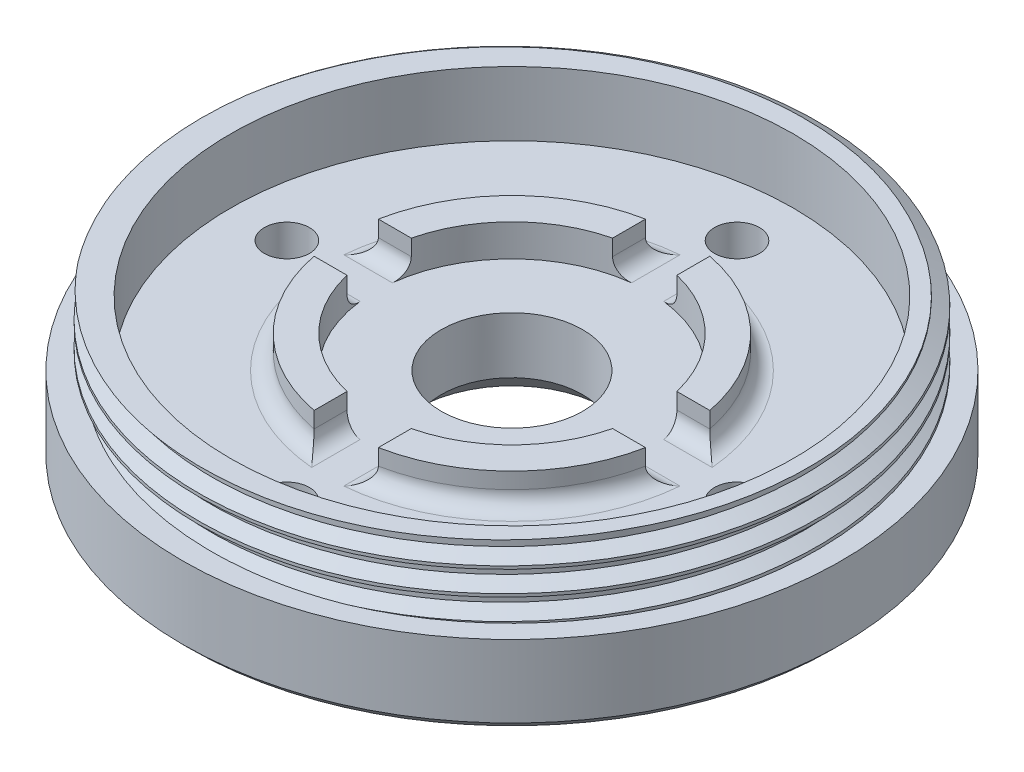
from build123d import *

# Parameters (mm, degrees)
SKETCH1_R       = 20.5
SKETCH1_R_2     = 4.4
SKETCH1_R_3     = 1.4
EXTRUDE1_DEPTH  = 5
SKETCH8_R       = 18.45
SKETCH8_R_2     = 17.5
EXTRUDE_1_DEPTH = 4
THREAD_1_PITCH  = 1.5
THREAD_1_FROM   = 2
EXTRUDE_2_DEPTH = 2
FILLET_1_R      = 1
CHAMFER2_SIZE   = 1.5
CHAMFER3_SIZE   = 0.5
CHAMFER4_SIZE   = 1


with BuildPart() as part:
    # Sketch1 → Extrude1 (new body)
    with BuildSketch(Plane(origin=(0, 0, 0), x_dir=(1, 0, 0), z_dir=(0, 1, 0))):
        with Locations(Location((0, 0, 0), (0, 0, 270))):
            Circle(SKETCH1_R)
        with Locations(Location((0, 0, 0), (0, 0, 270))):
            Circle(SKETCH1_R_2, mode=Mode.SUBTRACT)
        with Locations(Location((0, 14, 0), (0, 0, 270))):
            Circle(SKETCH1_R_3, mode=Mode.SUBTRACT)
        with Locations(Location((14, 0, 0), (0, 0, 270))):
            Circle(SKETCH1_R_3, mode=Mode.SUBTRACT)
        with Locations(Location((0, -14, 0), (0, 0, 270))):
            Circle(SKETCH1_R_3, mode=Mode.SUBTRACT)
        with Locations(Location((-14, 0, 0), (0, 0, 270))):
            Circle(SKETCH1_R_3, mode=Mode.SUBTRACT)
    extrude(amount=EXTRUDE1_DEPTH)

    # Sketch8 → Бобышка-Вытянуть1 (add)
    with BuildSketch(Plane(origin=(0, 5, 0), x_dir=(1, 0, 0), z_dir=(0, 1, 0))):
        with Locations(Location((0, 0, 0), (0, 0, 270))):
            Circle(SKETCH8_R)
        with Locations(Location((0, 0, 0), (0, 0, 270))):
            Circle(SKETCH8_R_2, mode=Mode.SUBTRACT)
    extrude(amount=EXTRUDE_1_DEPTH)

    # Резьба1: arcs per turn and ends read off the stored shape
    # Резьба1: the profile of Профиль резьбы1 profile screwed along a right-hand helix through 4 turns, 8 arcs to a turn; built about Z, then put on its axis
    thread_1_z = Axis((0, 0, 0), (0, 0, 1))
    thread_1_corners = [(18.4497, 0, -0.000173205), (19.261898813, 0, 0.468749998), (19.261898813, 0, 0.656249998), (18.4497, 0, 1.125173201)]
    with BuildLine(mode=Mode.PRIVATE) as thread_1_profile:
        Line(thread_1_corners[0], thread_1_corners[1])
        Line(thread_1_corners[1], thread_1_corners[2])
        Line(thread_1_corners[2], thread_1_corners[3])
        Line(thread_1_corners[3], thread_1_corners[0])
    thread_1_cap = Face(thread_1_profile.wire())
    thread_1_turn_angles = [0, 22.5, 45, 67.5, 90, 112.5, 135, 157.5, 180, 202.5, 225, 247.5, 270, 292.5, 315, 337.5, 360]
    thread_1_turn_weights = [1, 0.9238795325112867, 1, 0.9238795325112867, 1, 0.9238795325112867, 1, 0.9238795325112867, 1, 0.9238795325112867, 1, 0.9238795325112867, 1, 0.9238795325112867, 1, 0.9238795325112867, 1]
    thread_1_turn_rails = [Edge.make_bspline([Vector(p[0], p[1], 0).rotate(thread_1_z, thread_1_turn_angles[k]) / thread_1_turn_weights[k] + Vector(0, 0, p[2] + THREAD_1_PITCH * thread_1_turn_angles[k] / 360) for k in range(17)], [0, 0, 0, 1, 1, 2, 2, 3, 3, 4, 4, 5, 5, 6, 6, 7, 7, 8, 8, 8], 2, thread_1_turn_weights) for p in thread_1_corners]
    thread_1_turn_sides = [Face.make_surface_from_curves(thread_1_turn_rails[p[0]], thread_1_turn_rails[p[1]]) for p in [(0, 1), (1, 2), (2, 3), (3, 0)]]
    thread_1 = Plane(origin=(0, 11, 0), x_dir=(-1, 0, 0), z_dir=(0, -1, 0)) * split(Solid(Shell([*[p.moved(Location((0, 0, THREAD_1_PITCH * i))) for i in range(4) for p in thread_1_turn_sides], thread_1_cap, thread_1_cap.rotate(thread_1_z, 1440).moved(Location((0, 0, THREAD_1_PITCH * 1440 / 360)))])), bisect_by=Plane.XY.offset(THREAD_1_FROM), keep=Keep.TOP, mode=Mode.PRIVATE)
    add(thread_1)

    # Эскиз3 → Бобышка-Вытянуть2 (add)
    with BuildSketch(Plane(origin=(0, 5, 0), x_dir=(1, 0, 0), z_dir=(0, 1, 0))):
        with BuildLine():
            Line((-2, 10.307764064), (-2, 8.261355821))
            ThreePointArc((-2, 8.261355821), (-6.01040764, 6.01040764), (-8.261355821, 2))
            Line((-8.261355821, 2), (-10.307764064, 2))
            ThreePointArc((-10.307764064, 2), (-7.424621202, 7.424621202), (-2, 10.307764064))
        make_face()
        with BuildLine():
            Line((2, 10.307764064), (2, 8.261355821))
            ThreePointArc((2, 8.261355821), (6.01040764, 6.01040764), (8.261355821, 2))
            Line((8.261355821, 2), (10.307764064, 2))
            ThreePointArc((10.307764064, 2), (7.424621202, 7.424621202), (2, 10.307764064))
        make_face()
        with BuildLine():
            Line((10.307764064, -2), (8.261355821, -2))
            ThreePointArc((8.261355821, -2), (6.01040764, -6.01040764), (2, -8.261355821))
            Line((2, -8.261355821), (2, -10.307764064))
            ThreePointArc((2, -10.307764064), (7.424621202, -7.424621202), (10.307764064, -2))
        make_face()
        with BuildLine():
            Line((-2, -10.307764064), (-2, -8.261355821))
            ThreePointArc((-2, -8.261355821), (-6.01040764, -6.01040764), (-8.261355821, -2))
            Line((-8.261355821, -2), (-10.307764064, -2))
            ThreePointArc((-10.307764064, -2), (-7.424621202, -7.424621202), (-2, -10.307764064))
        make_face()
    extrude(amount=EXTRUDE_2_DEPTH)

    # Скругление1
    fillet_1_edges = [part.edges().sort_by_distance(p)[0] for p in [
        (-7.424621202, 5, -7.424621202),
        (-9.284559942, 5, -2),
        (-2, 5, -9.284559942),
        (7.424621202, 5, -7.424621202),
        (2, 5, -9.284559942),
        (9.284559942, 5, -2),
        (7.424621202, 5, 7.424621202),
        (9.284559942, 5, 2),
        (2, 5, 9.284559942),
        (-7.424621202, 5, 7.424621202),
        (-2, 5, 9.284559942),
        (-9.284559942, 5, 2),
    ]]
    fillet(fillet_1_edges, radius=FILLET_1_R)

    # Chamfer2
    chamfer2_edges = [part.edges().sort_by_distance(p)[0] for p in [
        (0, 0, -4.4),
    ]]
    chamfer(chamfer2_edges, length=CHAMFER2_SIZE)

    # Chamfer3
    chamfer3_edges = [part.edges().sort_by_distance(p)[0] for p in [
        (0, 0, -20.5),
    ]]
    chamfer(chamfer3_edges, length=CHAMFER3_SIZE)

    # Chamfer4
    chamfer4_edges = [part.edges().sort_by_distance(p)[0] for p in [
        (14, 0, -1.4),
        (0, 0, 12.6),
        (-14, 0, -1.4),
        (0, 0, -15.4),
    ]]
    chamfer(chamfer4_edges, length=CHAMFER4_SIZE)


solid = part.part
